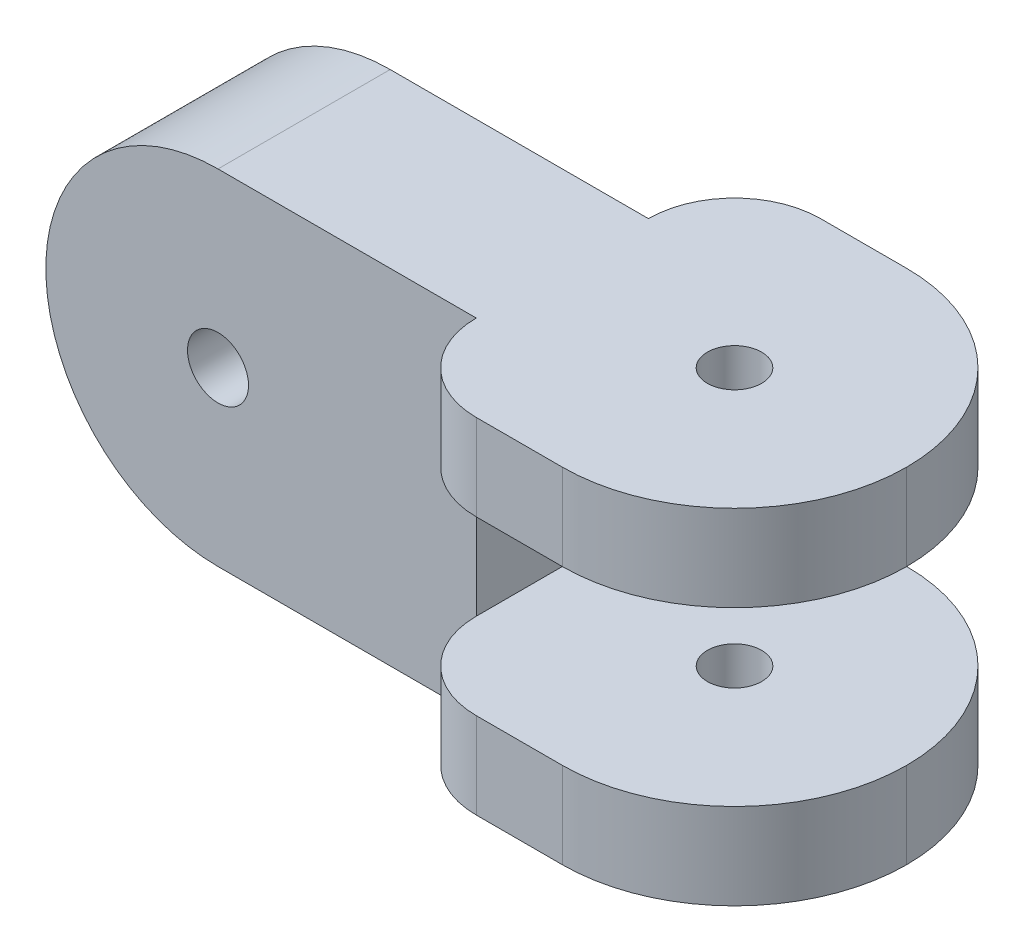
from build123d import *

# Parameters (mm, degrees)
SKETCH1_R           = 2.25
BOSS_EXTRUDE1_DEPTH = 12.7
SKETCH2_W           = 25.4
SKETCH2_H           = 25.4
BOSS_EXTRUDE2_DEPTH = 25.4
SKETCH3_W           = 25.4
SKETCH3_H           = 12.7
CUT_EXTRUDE1_DEPTH  = 25.4
FILLET2_R           = 6.35
FILLET3_R           = 12.7
SKETCH4_R           = 2
CUT_EXTRUDE2_DEPTH  = 25.4


with BuildPart() as part:
    # Sketch1 → Boss-Extrude1 (new body)
    with BuildSketch(Plane.XY):
        with BuildLine():
            Line((19.05, 12.7), (0, 12.7))
            ThreePointArc((0, 12.7), (-12.7, 0), (0, -12.7))
            Line((0, -12.7), (19.05, -12.7))
            Line((19.05, -12.7), (19.05, 12.7))
        make_face()
        Circle(SKETCH1_R, mode=Mode.SUBTRACT)
    extrude(amount=BOSS_EXTRUDE1_DEPTH)

    # Sketch2 → Boss-Extrude2 (add)
    with BuildSketch(Plane(origin=(19.05, 0, 0), x_dir=(0, 0, -1), z_dir=(1, 0, 0))):
        with Locations((-6.35, 0)):
            Rectangle(SKETCH2_W, SKETCH2_H)
    extrude(amount=BOSS_EXTRUDE2_DEPTH)

    # Sketch3 → Cut-Extrude1 (cut)
    with BuildSketch(Plane.XY.offset(19.05)):
        with Locations((31.75, 0)):
            Rectangle(SKETCH3_W, SKETCH3_H)
    extrude(amount=-CUT_EXTRUDE1_DEPTH, mode=Mode.SUBTRACT)

    # Fillet2
    fillet2_edges = [part.edges().sort_by_distance(p)[0] for p in [
        (19.05, 9.525, 19.05),
        (19.05, -9.525, 19.05),
        (19.05, -9.525, -6.35),
        (19.05, 9.525, -6.35),
    ]]
    fillet(fillet2_edges, radius=FILLET2_R - 0.0001)  # a hair under: the kernel refuses the full size

    # Fillet3
    fillet3_edges = [part.edges().sort_by_distance(p)[0] for p in [
        (44.45, 9.525, 19.05),
        (44.45, -9.525, 19.05),
        (44.45, 9.525, -6.35),
        (44.45, -9.525, -6.35),
    ]]
    fillet(fillet3_edges, radius=FILLET3_R - 0.0001)  # a hair under: the kernel refuses the full size

    # Sketch4 → Cut-Extrude2 (cut)
    with BuildSketch(Plane(origin=(0, 12.7, 0), x_dir=(1, 0, 0), z_dir=(0, 1, 0))):
        with Locations(Location((31.75, -6.35, 0), (0, 0, 270))):
            Circle(SKETCH4_R)
    extrude(amount=-CUT_EXTRUDE2_DEPTH, mode=Mode.SUBTRACT)


solid = part.part
